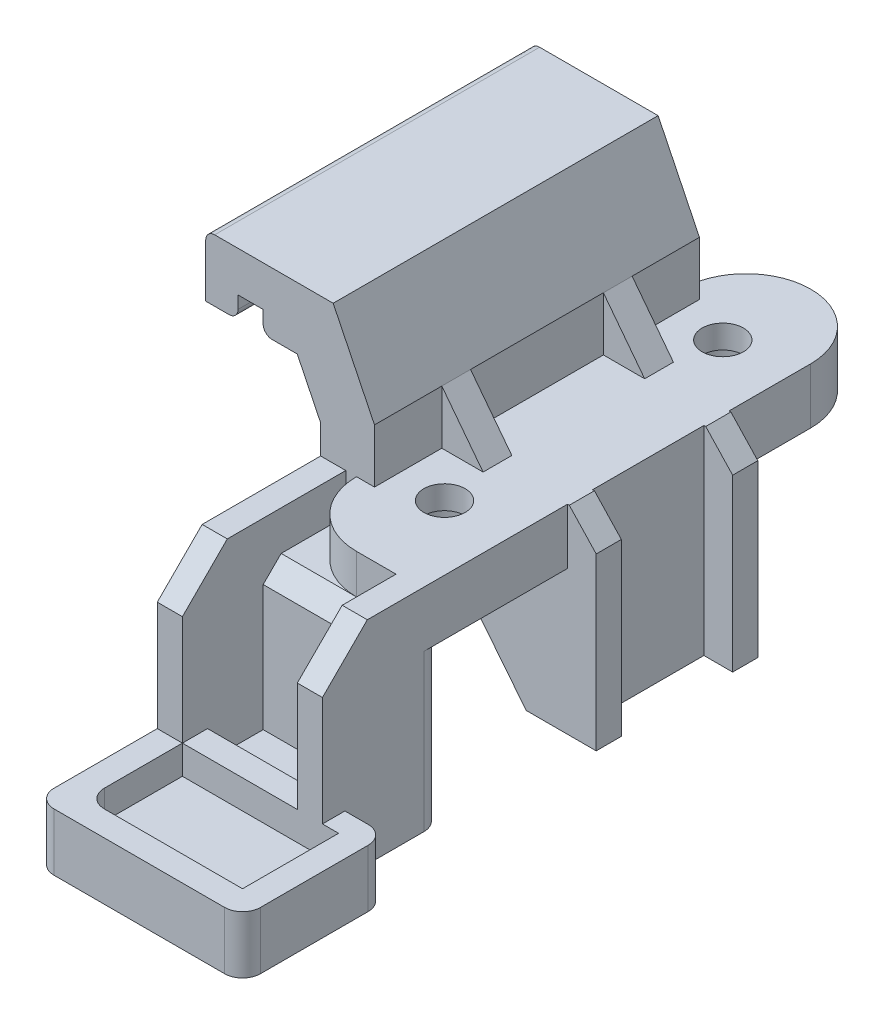
from build123d import *

# Parameters (mm, degrees)
EXTRUSION1_DEPTH                                  = 18.1
COQUE1_START                                      = 1.2
COQUE1_DEPTH                                      = 15.7
EXTRUSION2_DEPTH                                  = 3.1
ESQUISSE3_W                                       = 6.2
ESQUISSE3_H                                       = 18.1
EXTRUSION3_DEPTH                                  = 1.9
CHAMBRAGE_POUR_VIS_T_TE_HEXAGONALE_M2_D           = 2.3
CHAMBRAGE_POUR_VIS_T_TE_HEXAGONALE_M2_CBORE_D     = 4.5
CHAMBRAGE_POUR_VIS_T_TE_HEXAGONALE_M2_CBORE_DEPTH = 1.8
ENL_V_MAT_EXTRU_1_DEPTH                           = 1.6
EXTRUSION4_DEPTH                                  = 1.6
R_P_TITION_LIN_AIRE1_COUNT                        = 2
R_P_TITION_LIN_AIRE1_PITCH                        = 9
EXTRUSION5_DEPTH                                  = 8
EXTRUSION5_DIRECTION_2_REACH                      = 27.934
ENL_V_MAT_EXTRU_2_DEPTH                           = 23.973967556
EXTRUSION6_DEPTH                                  = 11.8
EXTRUSION7_DEPTH                                  = 9.6
CHANFREIN1_SIZE                                   = 1
ESQUISSE12_W                                      = 3.65
ESQUISSE12_H                                      = 8.7
ENL_V_MAT_EXTRU_3_DEPTH                           = 32.201293006
EXTRUSION8_DEPTH                                  = 3.2
ESQUISSE14_W                                      = 6.4
ESQUISSE14_H                                      = 3.1
ENL_V_MAT_EXTRU_4_DEPTH                           = 1.6
CONG_1_R                                          = 1
CONG_2_R                                          = 1


# Read off the part's stored shape, not the designer's step: Coque1
with BuildPart() as part:
    # Esquisse1 → Extrusion1 (new body)
    with BuildSketch(Plane.XY):
        with BuildLine():
            Line((0.5, 0), (9.2, 0))
            Line((9.2, 0), (9.2, 3.1))
            Line((9.2, 3.1), (3, 3.1))
            Line((3, 3.1), (3, 6.1))
            Line((3, 6.1), (0.698275932, 10.81853434))
            Line((0.698275932, 10.81853434), (-5.901724068, 10.81853434))
            ThreePointArc((-5.901724068, 10.81853434), (-6.255277459, 10.67208773), (-6.401724068, 10.31853434))
            Line((-6.401724068, 10.31853434), (-6.401724068, 7.36853434))
            Line((-6.401724068, 7.36853434), (-5.101724068, 7.36853434))
            ThreePointArc((-5.101724068, 7.36853434), (-4.748170678, 7.514980949), (-4.601724068, 7.86853434))
            Line((-4.601724068, 7.86853434), (-4.601724068, 8.56853434))
            Line((-4.601724068, 8.56853434), (-3.201724068, 8.56853434))
            Line((-3.201724068, 8.56853434), (-3.201724068, 7.86853434))
            ThreePointArc((-3.201724068, 7.86853434), (-3.055277459, 7.514980949), (-2.701724068, 7.36853434))
            Line((-2.701724068, 7.36853434), (-1.301724068, 7.36853434))
            Line((-1.301724068, 7.36853434), (0, 4.7))
            Line((0, 4.7), (0, 0.5))
            ThreePointArc((0, 0.5), (0.146446609, 0.146446609), (0.5, 0))
        make_face()
    extrude(amount=EXTRUSION1_DEPTH)

    # Coque1 outline → Coque1 (cut)
    with BuildSketch(Plane.XY.offset(COQUE1_START)):
        with BuildLine():
            Line((-5.201724068, 8.56853434), (-3.201724068, 8.56853434))
            Line((-3.201724068, 8.56853434), (-3.201724068, 7.86853434))
            ThreePointArc((-3.201724068, 7.86853434), (-3.055277459, 7.514980949), (-2.701724068, 7.36853434))
            Line((-2.701724068, 7.36853434), (-1.301724068, 7.36853434))
            Line((-1.301724068, 7.36853434), (0, 4.7))
            Line((0, 4.7), (0, 0.5))
            ThreePointArc((0, 0.5), (0.146446609, 0.146446609), (0.5, 0))
            Line((0.5, 0), (8, 0))
            Line((8, 0), (8, 1.9))
            Line((8, 1.9), (1.8, 1.9))
            Line((1.8, 1.9), (1.8, 5.822921265))
            Line((1.8, 5.822921265), (-0.051518573, 9.61853434))
            Line((-0.051518573, 9.61853434), (-5.201724068, 9.61853434))
            Line((-5.201724068, 9.61853434), (-5.201724068, 8.56853434))
        make_face()
    extrude(amount=COQUE1_DEPTH, mode=Mode.SUBTRACT)

    # Esquisse2 → Extrusion2 (add)
    with BuildSketch(Plane(origin=(0, 3.1, 0), x_dir=(-1, 0, 0), z_dir=(0, 1, 0))):
        with BuildLine():
            Line((-9.2, 0), (-2, 0))
            ThreePointArc((-2, 0), (-5.6, -3.6), (-9.2, 0))
        make_face()
        with BuildLine():
            Line((-9.2, 18.1), (-2, 18.1))
            ThreePointArc((-2, 18.1), (-5.6, 21.7), (-9.2, 18.1))
        make_face()
    extrude(amount=-EXTRUSION2_DEPTH)

    # Esquisse3 → Extrusion3 (add)
    with BuildSketch(Plane.XZ):
        with Locations((4.9, 9.05)):
            Rectangle(ESQUISSE3_W, ESQUISSE3_H)
    extrude(amount=-EXTRUSION3_DEPTH)

    # Chambrage pour vis à tête hexagonale M2.51 (through all)
    with Locations(Plane.XZ):
        with Locations((5.6, 1.3), (5.6, 16.8)):
            CounterBoreHole(CHAMBRAGE_POUR_VIS_T_TE_HEXAGONALE_M2_D / 2, CHAMBRAGE_POUR_VIS_T_TE_HEXAGONALE_M2_CBORE_D / 2, CHAMBRAGE_POUR_VIS_T_TE_HEXAGONALE_M2_CBORE_DEPTH)

    # Esquisse6 → Enlèv. mat.-Extru.1 (cut)
    with BuildSketch(Plane.XZ):
        with BuildLine():
            Line((3.75, 4.9), (7.45, 4.9))
            ThreePointArc((7.45, 4.9), (7.803553391, 5.046446609), (7.95, 5.4))
            Line((7.95, 5.4), (7.95, 12.7))
            ThreePointArc((7.95, 12.7), (7.803553391, 13.053553391), (7.45, 13.2))
            Line((7.45, 13.2), (3.75, 13.2))
            ThreePointArc((3.75, 13.2), (3.396446609, 13.053553391), (3.25, 12.7))
            Line((3.25, 12.7), (3.25, 5.4))
            ThreePointArc((3.25, 5.4), (3.396446609, 5.046446609), (3.75, 4.9))
        make_face()
    extrude(amount=-ENL_V_MAT_EXTRU_1_DEPTH, mode=Mode.SUBTRACT)

    # Esquisse7 → Extrusion4 (add)
    with BuildSketch(Plane.XY.offset(14.35)):
        Polygon((3, 6.1), (5.3, 3.1), (3, 3.1), align=None)
    extrusion4 = extrude(amount=-EXTRUSION4_DEPTH)

    # Répétition linéaire1: Extrusion4 ×2
    with Locations(*[(0, 0, -i * R_P_TITION_LIN_AIRE1_PITCH) for i in range(1, R_P_TITION_LIN_AIRE1_COUNT)]):
        add(extrusion4)

    # Esquisse8 → Extrusion5 (add)
    with BuildSketch(Plane.XZ):
        Polygon((10.8, 4.55), (1.8, 4.55), (1.8, 5.95), (7.95, 5.95), (7.95, 12.15), (1.8, 12.15), (1.8, 13.55), (10.8, 13.55), (10.8, 12.15), (9.2, 12.15), (9.2, 5.95), (10.8, 5.95), align=None)
    extrude(amount=EXTRUSION5_DEPTH)

    # Extrusion5 direction 2: up to this face of the body (flat: up to its plane)
    extrusion5_direction_2_end = Plane(part.part.faces().sort_by_distance((6.086516905, 3.1, 9.05))[0])
    # Esquisse8 → Extrusion5 direction 2 (add, up to the picked face)
    with BuildSketch(Plane.XZ, mode=Mode.PRIVATE) as extrusion5_direction_2_sk1:
        Polygon((10.8, 4.55), (1.8, 4.55), (1.8, 5.95), (7.95, 5.95), (7.95, 12.15), (1.8, 12.15), (1.8, 13.55), (10.8, 13.55), (10.8, 12.15), (9.2, 12.15), (9.2, 5.95), (10.8, 5.95), align=None)
    extrusion5_direction_2_tool1 = split(extrude(extrusion5_direction_2_sk1.sketch, amount=-EXTRUSION5_DIRECTION_2_REACH, mode=Mode.PRIVATE), bisect_by=extrusion5_direction_2_end, keep=Keep.BOTH, mode=Mode.PRIVATE)
    add(extrusion5_direction_2_tool1.solids().sort_by(Axis((6.3, 0, 4.677279), (0, 1, 0)))[0])

    # Esquisse9 → Enlèv. mat.-Extru.2 (cut, through all)
    with BuildSketch(Plane(origin=(0, 0, 4.55), x_dir=(-1, 0, 0), z_dir=(0, 0, -1))):
        Polygon((-6.9, -8), (-1.8, -8), (-1.8, -1.6), align=None)
        Polygon((-10.8, 3.1), (-10.8, 1.5), (-9.3, 3.1), align=None)
    extrude(amount=-ENL_V_MAT_EXTRU_2_DEPTH, mode=Mode.SUBTRACT)

    # Esquisse10 → Extrusion6 (add)
    with BuildSketch(Plane(origin=(0, 3.1, 0), x_dir=(-1, 0, 0), z_dir=(0, 1, 0))):
        with BuildLine():
            Line((-9.2, 17.467725461), (-9.2, 27.2))
            Line((-9.2, 27.2), (-7.8, 27.2))
            Line((-7.8, 27.2), (-7.8, 21.7))
            Line((-7.8, 21.7), (-5.6, 21.7))
            ThreePointArc((-5.6, 21.7), (-3.054415588, 20.645584412), (-2, 18.1))
            Line((-2, 18.1), (-1.4, 18.1))
            Line((-1.4, 18.1), (-1.4, 27.2))
            Line((-1.4, 27.2), (0, 27.2))
            Line((0, 27.2), (0, 16.9))
            Line((0, 16.9), (-1.097371231, 16.9))
            Line((-1.097371231, 16.9), (-5.6, 19.545108536))
            Line((-5.6, 19.545108536), (-9.2, 17.467725461))
        make_face()
    extrude(amount=-EXTRUSION6_DEPTH)

    # Esquisse11 → Extrusion7 (add)
    with BuildSketch(Plane(origin=(0, 0.9, 0), x_dir=(-1, 0, 0), z_dir=(0, 1, 0))):
        with BuildLine():
            Line((-1.4, 22.7), (-1.4, 18.1))
            Line((-1.4, 18.1), (-2, 18.1))
            ThreePointArc((-2, 18.1), (-3.054415588, 20.645584412), (-5.6, 21.7))
            Line((-5.6, 21.7), (-7.8, 21.7))
            Line((-7.8, 21.7), (-7.8, 22.7))
            Line((-7.8, 22.7), (-1.4, 22.7))
        make_face()
    extrude(amount=-EXTRUSION7_DEPTH)

    # Chanfrein1
    chanfrein1_edges = [part.edges().sort_by_distance(p)[0] for p in [
        (4.6, 0.9, 22.7),
    ]]
    chamfer(chanfrein1_edges, length=CHANFREIN1_SIZE - 0.0001)  # a hair under: the kernel refuses the full size

    # Esquisse12 → Enlèv. mat.-Extru.3 (cut, through all)
    with BuildSketch(Plane.ZY):
        with Locations((18.725, -4.35)):
            Rectangle(ESQUISSE12_W, ESQUISSE12_H)
        Polygon((27.2, 3.1), (24.7, 3.1), (27.2, 0.6), align=None)
    extrude(amount=-ENL_V_MAT_EXTRU_3_DEPTH, mode=Mode.SUBTRACT)

    # Esquisse13 → Extrusion8 (add)
    with BuildSketch(Plane.XZ.offset(8.7)):
        with BuildLine():
            Line((9.2, 20.55), (0, 20.55))
            Line((0, 20.55), (0, 32.95))
            ThreePointArc((0, 32.95), (0.292893219, 33.657106781), (1, 33.95))
            Line((1, 33.95), (9.2, 33.95))
            Line((9.2, 33.95), (10.5, 33.95))
            ThreePointArc((10.5, 33.95), (11.207106781, 33.657106781), (11.5, 32.95))
            Line((11.5, 32.95), (11.5, 26.95))
            ThreePointArc((11.5, 26.95), (11.207106781, 26.242893219), (10.5, 25.95))
            Line((10.5, 25.95), (9.2, 25.95))
            Line((9.2, 25.95), (9.2, 20.55))
        make_face()
    extrude(amount=-EXTRUSION8_DEPTH)

    # Esquisse14 → Enlèv. mat.-Extru.4 (cut)
    with BuildSketch(Plane(origin=(0, -5.5, 0), x_dir=(-1, 0, 0), z_dir=(0, 1, 0))):
        with BuildLine():
            Line((-10.1, 27.2), (-1.4, 27.2))
            Line((-1.4, 27.2), (-1.4, 31.55))
            ThreePointArc((-1.4, 31.55), (-1.692893219, 32.257106781), (-2.4, 32.55))
            Line((-2.4, 32.55), (-10.1, 32.55))
            Line((-10.1, 32.55), (-10.1, 27.2))
        make_face()
        with Locations((-4.6, 24.25)):
            Rectangle(ESQUISSE14_W, ESQUISSE14_H)
    extrude(amount=-ENL_V_MAT_EXTRU_4_DEPTH, mode=Mode.SUBTRACT)

    # Congé1
    cong_1_edges = [part.edges().sort_by_distance(p)[0] for p in [
        (9.2, -4.35, 20.55),
        (0, -4.35, 20.55),
    ]]
    fillet(cong_1_edges, radius=CONG_1_R)

    # Congé2
    cong_2_edges = [part.edges().sort_by_distance(p)[0] for p in [
        (0, 2.35, 16.9),
    ]]
    fillet(cong_2_edges, radius=CONG_2_R)


solid = part.part
